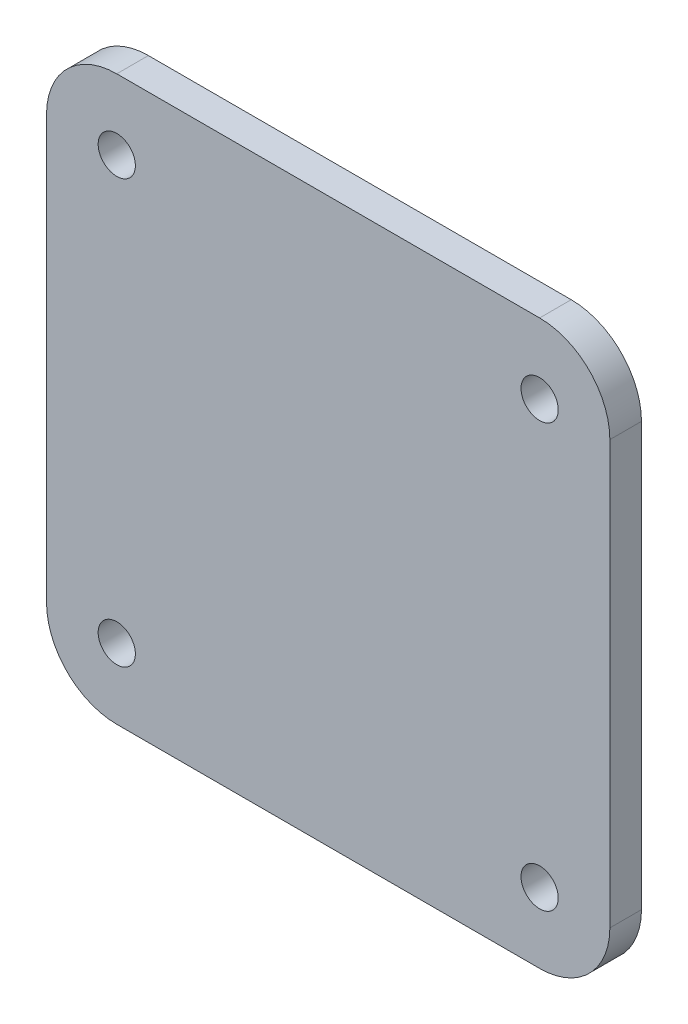
from build123d import *

# Parameters (mm, degrees)
SKETCH1_W            = 80.2
SKETCH1_H            = 80.2
BOSS_EXTRUDE1_DEPTH  = 4.5
M5_CLEARANCE_HOLE1_D = 5.3
FILLET1_R            = 10


with BuildPart() as part:
    # Sketch1 → Boss-Extrude1 (new body)
    with BuildSketch(Plane.XY):
        Rectangle(SKETCH1_W, SKETCH1_H)
    extrude(amount=BOSS_EXTRUDE1_DEPTH)

    # M5 Clearance Hole1 (through all)
    with Locations(Plane(origin=(30.1, 30.1, 0), x_dir=(-1, 0, 0), z_dir=(0, 0, -1))):
        with Locations((0, 0), (60.2, 0), (60.2, -60.2), (0, -60.2)):
            Hole(M5_CLEARANCE_HOLE1_D / 2)

    # Fillet1
    fillet1_edges = [part.edges().sort_by_distance(p)[0] for p in [
        (-40.1, 40.1, 2.25),
        (-40.1, -40.1, 2.25),
        (40.1, -40.1, 2.25),
        (40.1, 40.1, 2.25),
    ]]
    fillet(fillet1_edges, radius=FILLET1_R)


solid = part.part
